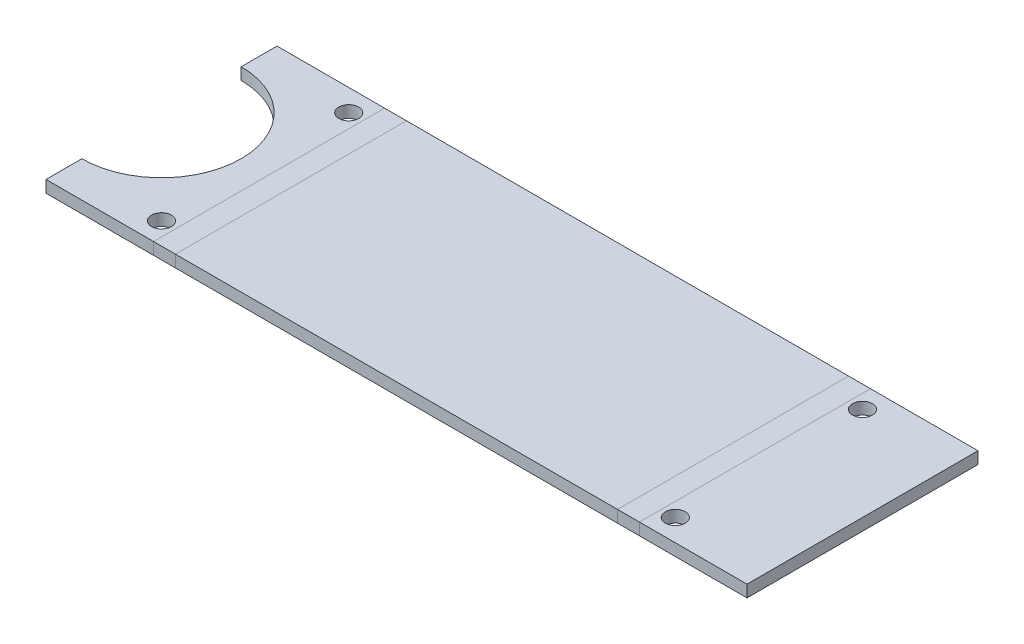
from build123d import *

# Parameters (mm, degrees)
SKETCH1_W              = 121
SKETCH1_H              = 58
BOSS_EXTRUDE1_DEPTH    = 3
SKETCH2_W              = 3
SKETCH2_H              = 58
BOSS_EXTRUDE2_DEPTH    = 29
SKETCH3_R              = 2.5
CUT_EXTRUDE1_DEPTH     = 29
CUT_EXTRUDE2_START     = -29
SKETCH4_R              = 2.5
CUT_EXTRUDE2_DEPTH     = 29
CONVERT_SOLID1_DEPTH   = 58
CONVERT_SOLID1_2_DEPTH = 58
UNFOLD1_START          = 3
UNFOLD1_OUTLINE_W      = 121
UNFOLD1_OUTLINE_H      = 58
UNFOLD1_DEPTH          = 29
UNFOLD1_2_OUTLINE_R    = 2.5
UNFOLD1_2_DEPTH        = 3


# Read off the part's stored shape, not the designer's step: Convert-Solid1, Unfold1
with BuildPart() as part:
    # Sketch1 → Boss-Extrude1 (new body)
    with BuildSketch(Plane(origin=(0, 0, 0), x_dir=(1, 0, 0), z_dir=(0, 1, 0))):
        with Locations((60.5, -29)):
            Rectangle(SKETCH1_W, SKETCH1_H)
    extrude(amount=BOSS_EXTRUDE1_DEPTH)

    # Sketch2 → Boss-Extrude2 (add)
    with BuildSketch(Plane(origin=(0, 3, 0), x_dir=(1, 0, 0), z_dir=(0, 1, 0))):
        with Locations((1.5, -29)):
            Rectangle(SKETCH2_W, SKETCH2_H)
        with Locations((119.5, -29)):
            Rectangle(SKETCH2_W, SKETCH2_H)
    extrude(amount=BOSS_EXTRUDE2_DEPTH)

    # Sketch3 → Cut-Extrude1 (cut)
    with BuildSketch(Plane.ZY):
        with Locations((5.5, 8.5)):
            Circle(SKETCH3_R)
        with Locations((52.5, 8.5)):
            Circle(SKETCH3_R)
        with BuildLine():
            Line((9, 32), (49, 32))
            ThreePointArc((49, 32), (29, 12), (9, 32))
        make_face()
    extrude(amount=-CUT_EXTRUDE1_DEPTH, mode=Mode.SUBTRACT)

    # Sketch4 → Cut-Extrude2 (cut)
    with BuildSketch(Plane(origin=(121, 0, 0), x_dir=(0, 0, -1), z_dir=(1, 0, 0)).offset(CUT_EXTRUDE2_START)):
        with Locations(Location((-52.5, 8.5, 0), (0, 0, 180))):
            Circle(SKETCH4_R)
        with Locations(Location((-5.5, 8.5, 0), (0, 0, 180))):
            Circle(SKETCH4_R)
    extrude(amount=CUT_EXTRUDE2_DEPTH, mode=Mode.SUBTRACT)

    # Convert-Solid1 outline → Convert-Solid1 (cut)
    with BuildSketch(Plane.XY):
        with BuildLine():
            Line((0, 0), (5, 0))
            ThreePointArc((5, 0), (1.464466094, 1.464466094), (0, 5))
            Line((0, 5), (0, 0))
        make_face()
        with BuildLine():
            ThreePointArc((121, 5), (119.535533906, 1.464466094), (116, 0))
            Line((116, 0), (121, 0))
            Line((121, 0), (121, 5))
        make_face()
    extrude(amount=CONVERT_SOLID1_DEPTH, mode=Mode.SUBTRACT)

    # Convert-Solid1 2 outline → Convert-Solid1 2 (add)
    with BuildSketch(Plane.XY):
        with BuildLine():
            Line((3, 3), (5, 3))
            ThreePointArc((5, 3), (3.585786438, 3.585786438), (3, 5))
            Line((3, 5), (3, 3))
        make_face()
        with BuildLine():
            ThreePointArc((118, 5), (117.414213562, 3.585786438), (116, 3))
            Line((116, 3), (118, 3))
            Line((118, 3), (118, 5))
        make_face()
    extrude(amount=CONVERT_SOLID1_2_DEPTH)

    # Unfold1 outline → Unfold1 (cut)
    with BuildSketch(Plane(origin=(0, 0, 0), x_dir=(1, 0, 0), z_dir=(0, 1, 0)).offset(UNFOLD1_START)):
        with Locations((60.5, -29)):
            Rectangle(UNFOLD1_OUTLINE_W, UNFOLD1_OUTLINE_H)
    extrude(amount=UNFOLD1_DEPTH, mode=Mode.SUBTRACT)

    # Unfold1 2 outline → Unfold1 2 (add)
    with BuildSketch(Plane(origin=(0, 0, 0), x_dir=(1, 0, 0), z_dir=(0, 1, 0))):
        with BuildLine():
            Line((-27.497787144, 0), (-27.497787144, -9))
            ThreePointArc((-27.497787144, -9), (-7.497787144, -29), (-27.497787144, -49))
            Line((-27.497787144, -49), (-27.497787144, -58))
            Line((-27.497787144, -58), (148.497787144, -58))
            Line((148.497787144, -58), (148.497787144, 0))
            Line((148.497787144, 0), (-27.497787144, 0))
        make_face()
        with Locations((124.997787144, -5.5)):
            Circle(UNFOLD1_2_OUTLINE_R, mode=Mode.SUBTRACT)
        with Locations((124.997787144, -52.5)):
            Circle(UNFOLD1_2_OUTLINE_R, mode=Mode.SUBTRACT)
        with Locations((-3.997787144, -5.5)):
            Circle(UNFOLD1_2_OUTLINE_R, mode=Mode.SUBTRACT)
        with Locations((-3.997787144, -52.5)):
            Circle(UNFOLD1_2_OUTLINE_R, mode=Mode.SUBTRACT)
    extrude(amount=UNFOLD1_2_DEPTH)


solid = part.part
